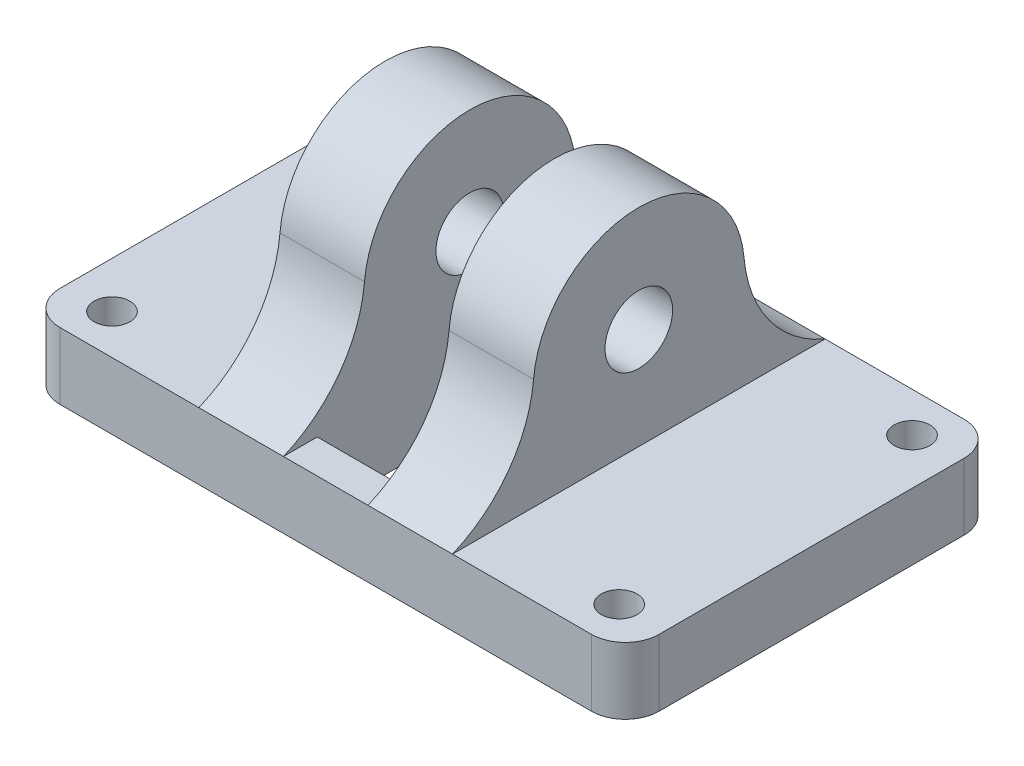
from build123d import *

# Parameters (mm, degrees)
SKETCH1_W           = 45.0088
SKETCH1_H           = 27.9908
BOSS_EXTRUDE1_DEPTH = 5.0038
SKETCH2_R           = 1.3462
CUT_EXTRUDE1_DEPTH  = 5.0038
FILLET1_R           = 2.54
BOSS_EXTRUDE2_START = 3.175
SKETCH3_R           = 7.9375
SKETCH3_R_2         = 2.54
BOSS_EXTRUDE2_DEPTH = 6.35
BOSS_EXTRUDE3_START = -9.525
SKETCH4_R           = 7.9375
SKETCH4_R_2         = 2.54
BOSS_EXTRUDE3_DEPTH = 6.35
FILLET2_R           = 10.000000066
SKETCH5_W           = 6.35
SKETCH5_H           = 22.9108
CUT_EXTRUDE2_DEPTH  = 56.238689053


with BuildPart() as part:
    # Sketch1 → Boss-Extrude1 (new body)
    with BuildSketch(Plane(origin=(0, 0, 0), x_dir=(1, 0, 0), z_dir=(0, 1, 0))):
        with Locations((22.5044, 13.9954)):
            Rectangle(SKETCH1_W, SKETCH1_H)
    extrude(amount=BOSS_EXTRUDE1_DEPTH)

    # Sketch2 → Cut-Extrude1 (cut)
    with BuildSketch(Plane(origin=(0, 5.0038, 0), x_dir=(1, 0, 0), z_dir=(0, 1, 0))):
        with Locations(Location((41.5544, 24.9936, 0), (0, 0, 270))):
            Circle(SKETCH2_R)
        with Locations(Location((41.5544, 2.9972, 0), (0, 0, 90))):
            Circle(SKETCH2_R)
        with Locations(Location((3.4544, 24.9936, 0), (0, 0, 90))):
            Circle(SKETCH2_R)
        with Locations(Location((3.4544, 2.9972, 0), (0, 0, 270))):
            Circle(SKETCH2_R)
    extrude(amount=-CUT_EXTRUDE1_DEPTH, mode=Mode.SUBTRACT)

    # Fillet1
    fillet1_edges = [part.edges().sort_by_distance(p)[0] for p in [
        (0, 2.5019, -27.9908),
        (45.0088, 2.5019, -27.9908),
        (45.0088, 2.5019, 0),
        (0, 2.5019, 0),
    ]]
    fillet(fillet1_edges, radius=FILLET1_R)

    # Sketch3 → Boss-Extrude2 (add)
    with BuildSketch(Plane(origin=(22.5044, 0, 0), x_dir=(0, 0, -1), z_dir=(1, 0, 0)).offset(BOSS_EXTRUDE2_START)):
        with Locations((13.9954, 12.6238)):
            Circle(SKETCH3_R)
        with Locations((13.9954, 12.6238)):
            Circle(SKETCH3_R_2, mode=Mode.SUBTRACT)
    extrude(amount=BOSS_EXTRUDE2_DEPTH)

    # Sketch4 → Boss-Extrude3 (add)
    with BuildSketch(Plane(origin=(22.5044, 0, 0), x_dir=(0, 0, -1), z_dir=(1, 0, 0)).offset(BOSS_EXTRUDE3_START)):
        with Locations((13.9954, 12.6238)):
            Circle(SKETCH4_R)
        with Locations((13.9954, 12.6238)):
            Circle(SKETCH4_R_2, mode=Mode.SUBTRACT)
    extrude(amount=BOSS_EXTRUDE3_DEPTH)

    # Fillet2
    # the kernel refuses this fillet: 10.000000066 mm, written as the material it adds along each edge
    with BuildSketch(Plane(origin=(32.0294, 5.0038, -16.2179), x_dir=(0, 0, -1), z_dir=(-1, 0, 0)), Plane(origin=(19.3294, 5.0038, -16.2179), x_dir=(0, 0, -1), z_dir=(-1, 0, 0))) as fillet2_piece_1:
        with BuildLine():
            CenterArc((15.643447864, -9.220567258), FILLET2_R, 112.771363132, 62.10931252)
            Line((5.683337527, -8.328264951), (5.484135321, -8.310418905))
            ThreePointArc((5.484135321, -8.310418905), (4.168656518, -3.258575394), (-0.056, -0.192000001))
            Line((-0.056, -0.192000001), (0, 0.200000001))
            ThreePointArc((0, 0.200000001), (5.88645, 0.200000001), (11.695489043, 0.184411345))
            Line((11.695489043, 0.184411345), (11.7729, 0))
        make_face()
    extrude(amount=6.35)
    with BuildSketch(Plane(origin=(32.0294, 5.0038, -16.2179), x_dir=(0, 0, -1), z_dir=(-1, 0, 0))) as fillet2_piece_2_section:
        with BuildLine():
            CenterArc((15.643447864, -9.220567258), FILLET2_R, 112.771363132, 62.10931252)
            Line((5.683337527, -8.328264951), (5.484135321, -8.310418905))
            ThreePointArc((5.484135321, -8.310418905), (4.168656518, -3.258575394), (-0.056, -0.192000001))
            Line((-0.056, -0.192000001), (0, 0.200000001))
            ThreePointArc((0, 0.200000001), (5.88645, 0.200000001), (11.695489043, 0.184411345))
            Line((11.695489043, 0.184411345), (11.7729, 0))
        make_face()
    fillet2_piece_2 = extrude(amount=35.78225, mode=Mode.PRIVATE)
    fillet2_piece_2 = split(fillet2_piece_2, bisect_by=Plane(origin=(12.9794, 6.888894544, -22.053995201), z_dir=(1, 0, 0)), keep=Keep.TOP, mode=Mode.PRIVATE)
    fillet2_piece_2 = split(fillet2_piece_2, bisect_by=Plane(origin=(19.3294, 6.888894544, -22.053995201), z_dir=(-1, 0, 0)), keep=Keep.TOP, mode=Mode.PRIVATE)
    add(fillet2_piece_2)
    with BuildSketch(Plane(origin=(32.0294, 5.0038, -11.7729), x_dir=(0, 0, 1), z_dir=(-1, 0, 0)), Plane(origin=(19.3294, 5.0038, -11.7729), x_dir=(0, 0, 1), z_dir=(-1, 0, 0))) as fillet2_piece_3:
        with BuildLine():
            CenterArc((15.643447864, 9.220567258), FILLET2_R, 185.119324348, 62.10931252)
            Line((5.683337527, 8.328264951), (5.484135321, 8.310418905))
            ThreePointArc((5.484135321, 8.310418905), (4.168656518, 3.258575394), (-0.056, 0.192000001))
            Line((-0.056, 0.192000001), (0, -0.200000001))
            ThreePointArc((0, -0.200000001), (5.88645, -0.200000001), (11.695489043, -0.184411345))
            Line((11.695489043, -0.184411345), (11.7729, 0))
        make_face()
    extrude(amount=6.35)
    with BuildSketch(Plane(origin=(32.0294, 5.0038, -11.7729), x_dir=(0, 0, 1), z_dir=(-1, 0, 0))) as fillet2_piece_4_section:
        with BuildLine():
            CenterArc((15.643447864, 9.220567258), FILLET2_R, 185.119324348, 62.10931252)
            Line((5.683337527, 8.328264951), (5.484135321, 8.310418905))
            ThreePointArc((5.484135321, 8.310418905), (4.168656518, 3.258575394), (-0.056, 0.192000001))
            Line((-0.056, 0.192000001), (0, -0.200000001))
            ThreePointArc((0, -0.200000001), (5.88645, -0.200000001), (11.695489043, -0.184411345))
            Line((11.695489043, -0.184411345), (11.7729, 0))
        make_face()
    fillet2_piece_4 = extrude(amount=35.78225, mode=Mode.PRIVATE)
    fillet2_piece_4 = split(fillet2_piece_4, bisect_by=Plane(origin=(12.9794, 6.888894544, -5.936804799), z_dir=(1, 0, 0)), keep=Keep.TOP, mode=Mode.PRIVATE)
    fillet2_piece_4 = split(fillet2_piece_4, bisect_by=Plane(origin=(19.3294, 6.888894544, -5.936804799), z_dir=(-1, 0, 0)), keep=Keep.TOP, mode=Mode.PRIVATE)
    add(fillet2_piece_4)
    with BuildSketch(Plane(origin=(48.76165, 5.0038, -11.7729), x_dir=(0, 0, 1), z_dir=(-1, 0, 0))) as fillet2_piece_5_section:
        with BuildLine():
            CenterArc((15.643447864, 9.220567258), FILLET2_R, 185.119324348, 62.10931252)
            Line((5.683337527, 8.328264951), (5.484135321, 8.310418905))
            ThreePointArc((5.484135321, 8.310418905), (4.168656518, 3.258575394), (-0.056, 0.192000001))
            Line((-0.056, 0.192000001), (0, -0.200000001))
            ThreePointArc((0, -0.200000001), (5.88645, -0.200000001), (11.695489043, -0.184411345))
            Line((11.695489043, -0.184411345), (11.7729, 0))
        make_face()
    fillet2_piece_5 = extrude(amount=35.78225, mode=Mode.PRIVATE)
    fillet2_piece_5 = split(fillet2_piece_5, bisect_by=Plane(origin=(25.6794, 6.888894544, -5.936804799), z_dir=(1, 0, 0)), keep=Keep.TOP, mode=Mode.PRIVATE)
    fillet2_piece_5 = split(fillet2_piece_5, bisect_by=Plane(origin=(32.0294, 6.888894544, -5.936804799), z_dir=(-1, 0, 0)), keep=Keep.TOP, mode=Mode.PRIVATE)
    add(fillet2_piece_5)
    with BuildSketch(Plane(origin=(48.76165, 5.0038, -16.2179), x_dir=(0, 0, -1), z_dir=(-1, 0, 0))) as fillet2_piece_6_section:
        with BuildLine():
            CenterArc((15.643447864, -9.220567258), FILLET2_R, 112.771363132, 62.10931252)
            Line((5.683337527, -8.328264951), (5.484135321, -8.310418905))
            ThreePointArc((5.484135321, -8.310418905), (4.168656518, -3.258575394), (-0.056, -0.192000001))
            Line((-0.056, -0.192000001), (0, 0.200000001))
            ThreePointArc((0, 0.200000001), (5.88645, 0.200000001), (11.695489043, 0.184411345))
            Line((11.695489043, 0.184411345), (11.7729, 0))
        make_face()
    fillet2_piece_6 = extrude(amount=35.78225, mode=Mode.PRIVATE)
    fillet2_piece_6 = split(fillet2_piece_6, bisect_by=Plane(origin=(25.6794, 6.888894544, -22.053995201), z_dir=(1, 0, 0)), keep=Keep.TOP, mode=Mode.PRIVATE)
    fillet2_piece_6 = split(fillet2_piece_6, bisect_by=Plane(origin=(32.0294, 6.888894544, -22.053995201), z_dir=(-1, 0, 0)), keep=Keep.TOP, mode=Mode.PRIVATE)
    add(fillet2_piece_6)

    # Sketch5 → Cut-Extrude2 (cut, through all)
    with BuildSketch(Plane(origin=(0, 5.0038, 0), x_dir=(1, 0, 0), z_dir=(0, 1, 0))):
        with Locations((22.5044, 13.9954)):
            Rectangle(SKETCH5_W, SKETCH5_H)
    extrude(amount=-CUT_EXTRUDE2_DEPTH, mode=Mode.SUBTRACT)


solid = part.part
